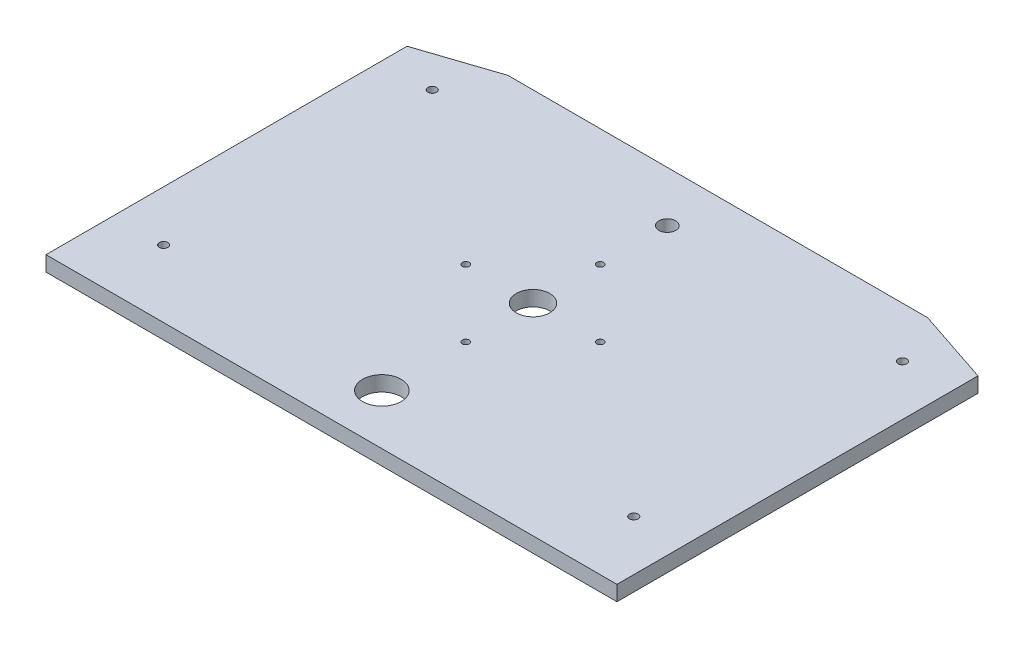
from build123d import *

# Parameters (mm, degrees)
ESQUISSE3_R             = 2.55
STRUCTURE_DEPTH         = 9
ESQUISSE4_R             = 10
ESQUISSE4_R_2           = 11.5
ESQUISSE4_R_3           = 2.05
ESQUISSE4_R_4           = 5
ENL_V_MAT_EXTRU_1_DEPTH = 10


with BuildPart() as part:
    # Esquisse3 → structure (new body)
    with BuildSketch(Plane(origin=(0, 0, 0), x_dir=(1, 0, 0), z_dir=(0, 1, 0))):
        Polygon((170, 95), (125, 110), (-125, 110), (-170, 95), (-170, 0), (-170, -120), (170, -120), (170, 0), align=None)
        with Locations((-140, -80)):
            Circle(ESQUISSE3_R, mode=Mode.SUBTRACT)
        with Locations((140, -80)):
            Circle(ESQUISSE3_R, mode=Mode.SUBTRACT)
        with Locations((-140, 80)):
            Circle(ESQUISSE3_R, mode=Mode.SUBTRACT)
        with Locations((140, 80)):
            Circle(ESQUISSE3_R, mode=Mode.SUBTRACT)
    extrude(amount=-STRUCTURE_DEPTH)

    # Esquisse4 → Enlèv. mat.-Extru.1 (cut)
    with BuildSketch(Plane(origin=(0, 0, 0), x_dir=(1, 0, 0), z_dir=(0, 1, 0))):
        Circle(ESQUISSE4_R)
        with Locations((0, -90)):
            Circle(ESQUISSE4_R_2)
        with Locations((0, 40)):
            Circle(ESQUISSE4_R_3)
        with Locations((40, 0)):
            Circle(ESQUISSE4_R_3)
        with Locations((0, -40)):
            Circle(ESQUISSE4_R_3)
        with Locations((-40, 0)):
            Circle(ESQUISSE4_R_3)
        with Locations((0, 80)):
            Circle(ESQUISSE4_R_4)
    extrude(amount=-ENL_V_MAT_EXTRU_1_DEPTH, mode=Mode.SUBTRACT)


solid = part.part
